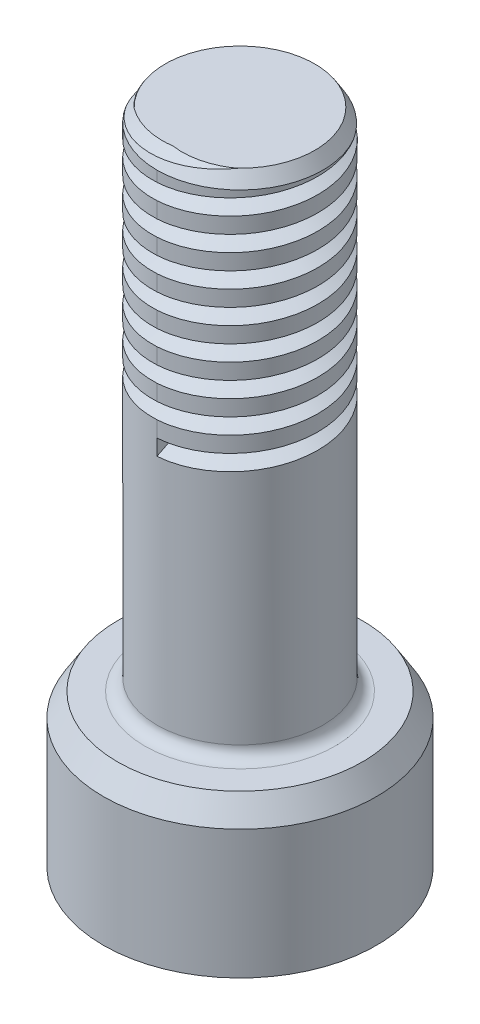
from build123d import *

# Parameters (mm, degrees)
CUT_SWEEP1_PITCH   = 0.793751588
CUT_EXTRUDE1_DEPTH = 1.955803912
FILLET1_R          = 0.30480061
FILLET2_R          = 0.396875794
CHAMFER3_SIZE      = 0.127


with BuildPart() as part:
    # Sketch1 → Revolve1 (revolve)
    with BuildSketch(Plane.XY, mode=Mode.PRIVATE) as revolve1_sk:
        Polygon((0, 0), (0, 16.865608331), (2.082804166, 16.865608331), (2.082804166, 4.165608331), (3.429006858, 4.165608331), (3.429006858, 0), align=None)
    revolve(revolve1_sk.sketch.rotate(Axis((0, 0, 0), (0, 1, 0)), 90), axis=Axis((0, 0, 0), (0, 1, 0)))

    # Cut-Sweep1: arcs per turn and ends read off the stored shape
    # Cut-Sweep1: the profile of Sketch3 profile screwed along a right-hand helix through 9 turns, 8 arcs to a turn; built about Z, then put on its axis
    cut_sweep1_z = Axis((0, 0, 0), (0, 0, 1))
    cut_sweep1_corners = [(2.083104166, 0, -0.595163691), (2.083104166, 0, -0.992339484), (1.685928372, 0, -0.793751588)]
    with BuildLine(mode=Mode.PRIVATE) as cut_sweep1_profile:
        Line(cut_sweep1_corners[0], cut_sweep1_corners[1])
        Line(cut_sweep1_corners[1], cut_sweep1_corners[2])
        Line(cut_sweep1_corners[2], cut_sweep1_corners[0])
    cut_sweep1_cap = Face(cut_sweep1_profile.wire())
    cut_sweep1_turn_angles = [0, 22.5, 45, 67.5, 90, 112.5, 135, 157.5, 180, 202.5, 225, 247.5, 270, 292.5, 315, 337.5, 360]
    cut_sweep1_turn_weights = [1, 0.9238795325112867, 1, 0.9238795325112867, 1, 0.9238795325112867, 1, 0.9238795325112867, 1, 0.9238795325112867, 1, 0.9238795325112867, 1, 0.9238795325112867, 1, 0.9238795325112867, 1]
    cut_sweep1_turn_rails = [Edge.make_bspline([Vector(p[0], p[1], 0).rotate(cut_sweep1_z, cut_sweep1_turn_angles[k]) / cut_sweep1_turn_weights[k] + Vector(0, 0, p[2] + CUT_SWEEP1_PITCH * cut_sweep1_turn_angles[k] / 360) for k in range(17)], [0, 0, 0, 1, 1, 2, 2, 3, 3, 4, 4, 5, 5, 6, 6, 7, 7, 8, 8, 8], 2, cut_sweep1_turn_weights) for p in cut_sweep1_corners]
    cut_sweep1_turn_sides = [Face.make_surface_from_curves(cut_sweep1_turn_rails[p[0]], cut_sweep1_turn_rails[p[1]]) for p in [(0, 1), (1, 2), (2, 0)]]
    cut_sweep1 = Plane(origin=(0, 16.865608331, 0), x_dir=(0, 0, 1), z_dir=(0, -1, 0)) * Solid(Shell([*[p.moved(Location((0, 0, CUT_SWEEP1_PITCH * i))) for i in range(9) for p in cut_sweep1_turn_sides], cut_sweep1_cap, cut_sweep1_cap.rotate(cut_sweep1_z, 3240).moved(Location((0, 0, CUT_SWEEP1_PITCH * 3240 / 360)))]))
    add(cut_sweep1, mode=Mode.SUBTRACT)

    # Sketch4 → Cut-Extrude1 (cut)
    with BuildSketch(Plane(origin=(0, 0, 0), x_dir=(1, 0, 0), z_dir=(0, 1, 0))):
        Polygon((0, 2.06772639), (-1.790703581, 1.033863195), (-1.790703581, -1.033863195), (0, -2.06772639), (1.790703581, -1.033863195), (1.790703581, 1.033863195), align=None)
    extrude(amount=CUT_EXTRUDE1_DEPTH, mode=Mode.SUBTRACT)

    # Fillet1
    fillet1_edges = [part.edges().sort_by_distance(p)[0] for p in [
        (0, 4.165608331, 2.082804166),
    ]]
    fillet(fillet1_edges, radius=FILLET1_R)

    # Fillet2
    fillet2_edges = [part.edges().sort_by_distance(p)[0] for p in [
        (1.790703581, 0.977901956, -1.033863195),
        (0, 0.977901956, -2.06772639),
        (-1.790703581, 0.977901956, -1.033863195),
        (-1.790703581, 0.977901956, 1.033863195),
        (0, 0.977901956, 2.06772639),
        (1.790703581, 0.977901956, 1.033863195),
        (0.895351791, 1.955803912, -1.550794792),
        (-0.895351791, 1.955803912, -1.550794792),
        (-1.790703581, 1.955803912, 0),
        (-0.895351791, 1.955803912, 1.550794792),
        (0.895351791, 1.955803912, 1.550794792),
        (1.790703581, 1.955803912, 0),
    ]]
    fillet(fillet2_edges, radius=FILLET2_R)

    # Chamfer1: read off the stored shape, not the designer's step
    # Chamfer1 outline → Chamfer1 (revolve, cut)
    with BuildSketch(Plane.XY):
        Polygon((2.082804166, 16.865608331), (1.879603759, 16.865608331), (2.082804166, 16.536469354), align=None)
    revolve(axis=Axis((0, 0, 0), (0, 1, 0)), mode=Mode.SUBTRACT)

    # Chamfer2: read off the stored shape, not the designer's step
    # Chamfer2 outline → Chamfer2 (revolve, cut)
    with BuildSketch(Plane.XY):
        Polygon((2.853013648, 0), (3.429006858, 0), (3.429006858, 0.355600711), align=None)
        Polygon((3.073406147, 4.165608331), (3.429006858, 3.589615121), (3.429006858, 4.165608331), align=None)
    revolve(axis=Axis((0, 0, 0), (0, 1, 0)), mode=Mode.SUBTRACT)

    # Chamfer3
    chamfer3_edges = [part.edges().sort_by_distance(p)[0] for p in [
        (0.895351791, 0, -1.550794792),
        (-0.895351791, 0, -1.550794792),
        (-1.790703581, 0, 0),
        (-0.895351791, 0, 1.550794792),
        (0.895351791, 0, 1.550794792),
        (1.790703581, 0, 0),
        (0, 0, -2.006329491),
        (1.737532307, 0, -1.003164745),
        (1.737532307, 0, 1.003164745),
        (0, 0, 2.006329491),
        (-1.737532307, 0, 1.003164745),
        (-1.737532307, 0, -1.003164745),
    ]]
    chamfer(chamfer3_edges, length=CHAMFER3_SIZE)


solid = part.part
